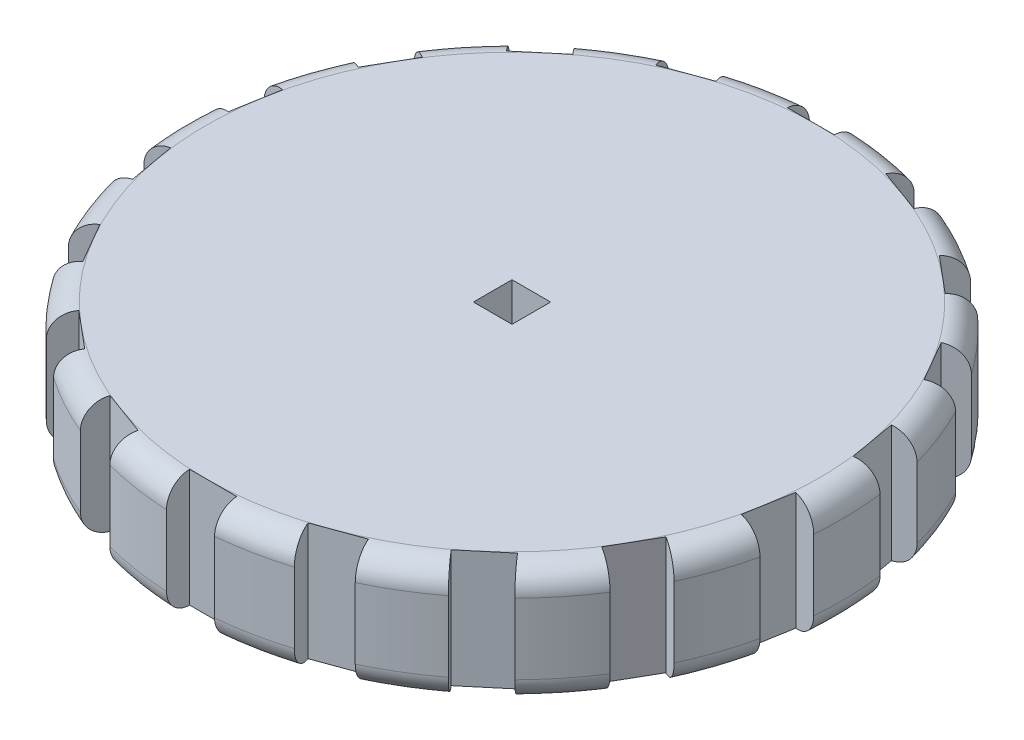
from build123d import *

# Parameters (mm, degrees)
SKETCH_1_R          = 7
EXTRUDE_1_DEPTH     = 2.5
SKETCH_3_R          = 2
EXTRUDE_3_DEPTH     = 1.5
FILLET_2_R          = 0.5
SKETCH_4_W          = 1
SKETCH_4_H          = 1.5
CUT_EXTRUDE_1_DEPTH = 10
SKETCH_2_W          = 0.82
SKETCH_2_H          = 0.82
CUT_EXTRUDE_2_DEPTH = 2.5


with BuildPart() as part:
    # 草图1 → 凸台-拉伸1 (new body)
    with BuildSketch(Plane(origin=(0, 0, 0), x_dir=(1, 0, 0), z_dir=(0, 1, 0))):
        with Locations((-28.569838241, 1.786718145)):
            Circle(SKETCH_1_R)
    extrude(amount=EXTRUDE_1_DEPTH)

    # 草图3 → 凸台-拉伸3 (add)
    with BuildSketch(Plane.XZ):
        with Locations((-28.569838241, -1.786718145)):
            Circle(SKETCH_3_R)
    extrude(amount=EXTRUDE_3_DEPTH)

    # 圆角2
    fillet_2_edges = [part.edges().sort_by_distance(p)[0] for p in [
        (-35.569838241, 0, -1.786718145),
        (-35.569838241, 2.5, -1.786718145),
    ]]
    fillet(fillet_2_edges, radius=FILLET_2_R)

    # 草图4 → 切除-拉伸1 (cut)
    with BuildSketch(Plane(origin=(0, 2.5, 0), x_dir=(1, 0, 0), z_dir=(0, 1, 0))):
        with Locations((-28.417730855, -5.463281855)):
            Rectangle(SKETCH_4_W, SKETCH_4_H)
        Polygon((-31.119881294, -4.202297609), (-31.632911509, -5.61183654), (-30.693218889, -5.953856683), (-30.180188674, -4.544317752), align=None)
        Polygon((-33.014458907, -2.968949674), (-33.978640322, -4.118016339), (-33.212595879, -4.760803949), (-32.248414464, -3.611737284), align=None)
        Polygon((-34.372949672, -1.161998014), (-35.671987778, -1.911998014), (-35.171987778, -2.778023418), (-33.872949672, -2.028023418), align=None)
        Polygon((-35.031499554, 1.000612333), (-36.508711183, 0.740140066), (-36.335063006, -0.244667687), (-34.857851376, 0.01580458), align=None)
        Polygon((-34.910677717, 3.258038642), (-36.387889347, 3.518510909), (-36.561537524, 2.533703156), (-35.084325895, 2.273230889), align=None)
        Polygon((-34.025057059, 5.338001986), (-35.324095165, 6.088001986), (-35.824095165, 5.221976582), (-34.525057059, 4.471976582), align=None)
        Polygon((-32.481456501, 6.989628086), (-33.445637915, 8.138694751), (-34.211682358, 7.495907141), (-33.247500944, 6.346840477), align=None)
        Polygon((-30.466057051, 8.013706461), (-30.979087266, 9.423245392), (-31.918779887, 9.081225249), (-31.405749672, 7.671686318), align=None)
        with Locations((-28.721945627, 9.036718145)):
            Rectangle(SKETCH_4_W, SKETCH_4_H)
        Polygon((-26.019795188, 7.775733898), (-25.506764973, 9.185272829), (-26.446457593, 9.527292973), (-26.959487808, 8.117754041), align=None)
        Polygon((-24.125217575, 6.542385963), (-23.16103616, 7.691452628), (-23.927080603, 8.334240238), (-24.891262018, 7.185173573), align=None)
        Polygon((-22.76672681, 4.735434303), (-21.467688704, 5.485434303), (-21.967688704, 6.351459707), (-23.26672681, 5.601459707), align=None)
        Polygon((-22.108176928, 2.572823956), (-20.630965299, 2.833296223), (-20.804613476, 3.818103976), (-22.281825106, 3.557631709), align=None)
        Polygon((-22.228998765, 0.315397647), (-20.751787135, 0.05492538), (-20.578138958, 1.039733133), (-22.055350587, 1.3002054), align=None)
        Polygon((-23.114619423, -1.764565697), (-21.815581318, -2.514565697), (-21.315581318, -1.648540293), (-22.614619423, -0.898540293), align=None)
        Polygon((-24.658219981, -3.416191797), (-23.694038567, -4.565258462), (-22.927994124, -3.922470852), (-23.892175538, -2.773404187), align=None)
        Polygon((-26.673619431, -4.440270172), (-26.160589216, -5.849809103), (-25.220896595, -5.50778896), (-25.73392681, -4.098250029), align=None)
    extrude(amount=-CUT_EXTRUDE_1_DEPTH, mode=Mode.SUBTRACT)

    # 草图2 → 切除-拉伸2 (cut)
    with BuildSketch(Plane(origin=(0, 2.5, 0), x_dir=(1, 0, 0), z_dir=(0, 1, 0))):
        with Locations((-28.569838241, 1.786718145)):
            Rectangle(SKETCH_2_W, SKETCH_2_H)
    extrude(amount=-CUT_EXTRUDE_2_DEPTH, mode=Mode.SUBTRACT)


solid = part.part
